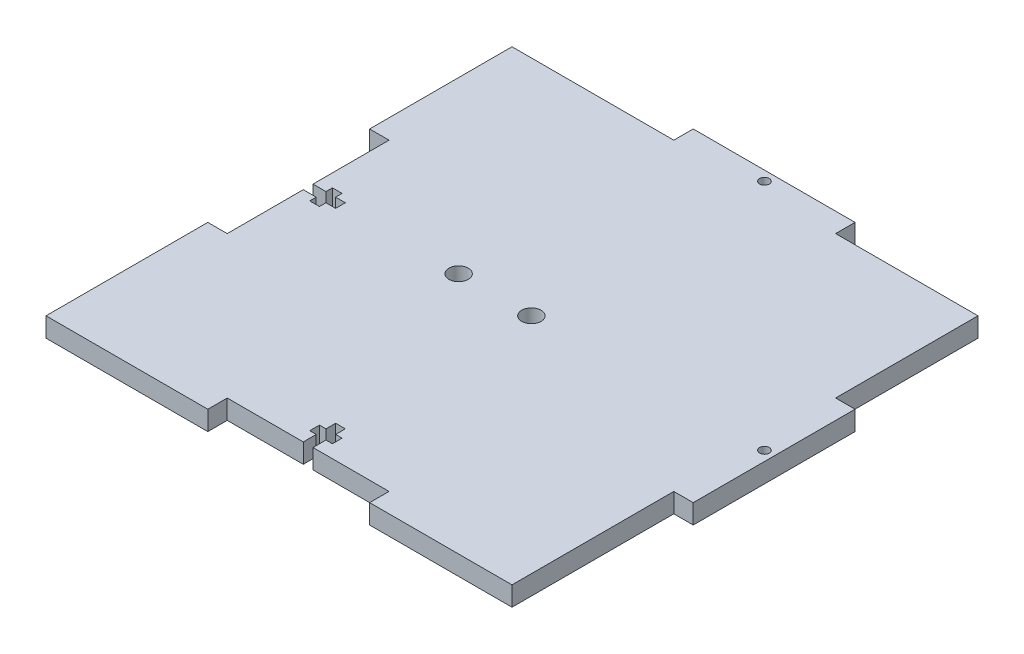
from build123d import *

# Parameters (mm, degrees)
SKETCH1_R           = 3
SKETCH1_R_2         = 1.5
BOSS_EXTRUDE1_DEPTH = 6


with BuildPart() as part:
    # Sketch1 → Boss-Extrude1 (new body)
    with BuildSketch(Plane(origin=(0, 0, 0), x_dir=(1, 0, 0), z_dir=(0, 1, 0))):
        Polygon((-72, 72), (-72, 28), (-66, 28), (-66, 4.5), (-62, 4.5), (-62, 6.5), (-59, 6.5), (-59, 4.5), (-56, 4.5), (-56, 1.5), (-59, 1.5), (-59, -0.5), (-62, -0.5), (-62, 1.5), (-66, 1.5), (-66, -22), (-72, -22), (-72, -72), (-22, -72), (-22, -66), (1.5, -66), (1.5, -62), (-0.5, -62), (-0.5, -59), (1.5, -59), (1.5, -56), (4.5, -56), (4.5, -59), (6.5, -59), (6.5, -62), (4.5, -62), (4.5, -66), (28, -66), (28, -72), (72, -72), (72, -22), (78, -22), (78, 28), (72, 28), (72, 72), (28, 72), (28, 78), (-22, 78), (-22, 72), align=None)
        with Locations((-19.5, 3)):
            Circle(SKETCH1_R, mode=Mode.SUBTRACT)
        with Locations((3, 3)):
            Circle(SKETCH1_R, mode=Mode.SUBTRACT)
        with Locations((3, 75)):
            Circle(SKETCH1_R_2, mode=Mode.SUBTRACT)
        with Locations((75, 3)):
            Circle(SKETCH1_R_2, mode=Mode.SUBTRACT)
    extrude(amount=BOSS_EXTRUDE1_DEPTH)


solid = part.part
